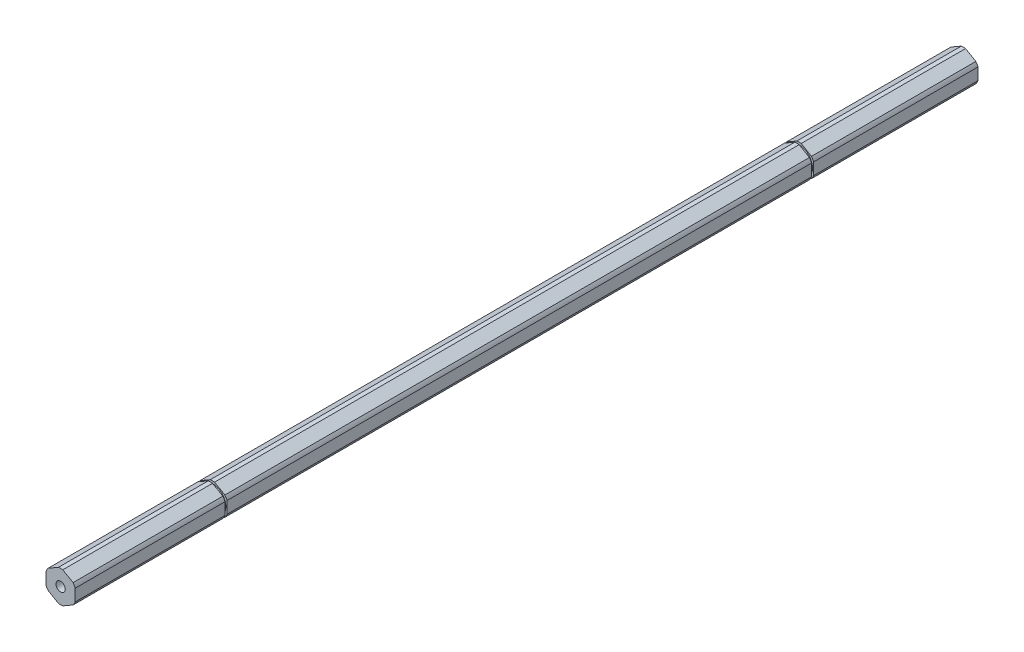
from build123d import *

# Parameters (mm, degrees)
BOSS_EXTRUDE1_DEPTH = 196.1515
SKETCH2_R           = 2.0193
CUT_EXTRUDE1_DEPTH  = 393.414319913
SKETCH4_W           = 3.175
SKETCH4_H           = 0.889


with BuildPart() as part:
    # Sketch1 → Boss-Extrude1 (new, symmetric)
    with BuildSketch(Plane.XY):
        with BuildLine():
            ThreePointArc((0.93173274, 6.79441227), (0, 6.858), (-0.93173274, 6.79441227))
            Line((-0.93173274, 6.79441227), (-5.41826726, 4.204110358))
            ThreePointArc((-5.41826726, 4.204110358), (-5.939202219, 3.429), (-6.35, 2.590301913))
            Line((-6.35, 2.590301913), (-6.35, -2.590301913))
            ThreePointArc((-6.35, -2.590301913), (-5.939202219, -3.429), (-5.41826726, -4.204110358))
            Line((-5.41826726, -4.204110358), (-0.93173274, -6.79441227))
            ThreePointArc((-0.93173274, -6.79441227), (0, -6.858), (0.93173274, -6.79441227))
            Line((0.93173274, -6.79441227), (5.41826726, -4.204110358))
            ThreePointArc((5.41826726, -4.204110358), (5.939202219, -3.429), (6.35, -2.590301913))
            Line((6.35, -2.590301913), (6.35, 2.590301913))
            ThreePointArc((6.35, 2.590301913), (5.939202219, 3.429), (5.41826726, 4.204110358))
            Line((5.41826726, 4.204110358), (0.93173274, 6.79441227))
        make_face()
    extrude(amount=BOSS_EXTRUDE1_DEPTH, both=True)

    # Sketch2 → Cut-Extrude1 (cut, through all)
    with BuildSketch(Plane.XY.offset(196.1515)):
        Circle(SKETCH2_R)
    extrude(amount=-CUT_EXTRUDE1_DEPTH, mode=Mode.SUBTRACT)

    # Sketch4 → Cut-Revolve4 (revolve, cut)
    with BuildSketch(Plane(origin=(0, 0, 0), x_dir=(1, 0, 0), z_dir=(0, 1, 0))):
        with Locations((7.4422, 124.2822)):
            Rectangle(SKETCH4_W, SKETCH4_H)
        with Locations((7.4422, -130.6322)):
            Rectangle(SKETCH4_W, SKETCH4_H)
    revolve(axis=Axis((0, 0, -196.1515), (0, 0, 1)), mode=Mode.SUBTRACT)


solid = part.part
